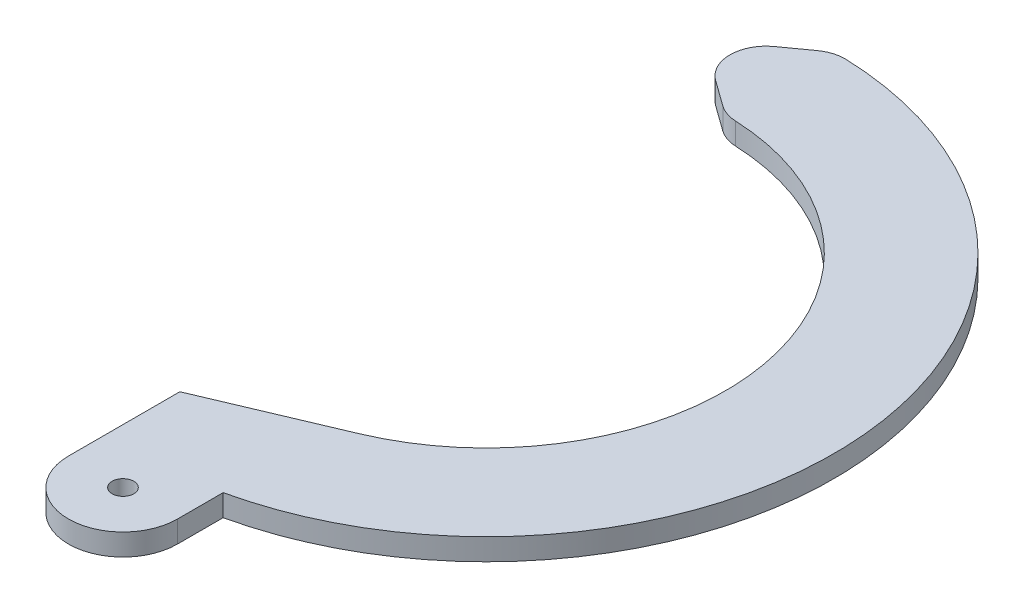
from build123d import *

# Parameters (mm, degrees)
SKETCH1_R           = 1.5
BOSS_EXTRUDE2_DEPTH = 3
FILLET1_R           = 5
FILLET2_R           = 5
CUT_EXTRUDE1_DEPTH  = 3


with BuildPart() as part:
    # Sketch1 → Boss-Extrude2 (new body)
    with BuildSketch(Plane(origin=(0, 0, 0), x_dir=(1, 0, 0), z_dir=(0, 1, 0))):
        with BuildLine():
            Line((-4.553675432, -32.684308774), (-4.553675432, -53.14))
            ThreePointArc((-4.553675432, -53.14), (2.973162284, -60.666837716), (10.5, -53.14))
            Line((10.5, -53.14), (10.5, -46.837484988))
            ThreePointArc((10.5, -46.837484988), (47.708486035, 5.282079163), (0, 48))
            Line((0, 48), (-10.422195737, 40.5))
            Line((-10.422195737, 40.5), (0, 33))
            ThreePointArc((0, 33), (32.920982591, -2.282302614), (-4.553675432, -32.684308774))
        make_face()
        with Locations((2.973162284, -53.14)):
            Circle(SKETCH1_R, mode=Mode.SUBTRACT)
    extrude(amount=BOSS_EXTRUDE2_DEPTH)

    # Fillet1
    fillet1_edges = [part.edges().sort_by_distance(p)[0] for p in [
        (-10.422195737, 1.5, -40.5),
    ]]
    fillet(fillet1_edges, radius=FILLET1_R)

    # Fillet2
    fillet2_edges = [part.edges().sort_by_distance(p)[0] for p in [
        (0, 1.5, -48),
        (0, 1.5, -33),
    ]]
    fillet(fillet2_edges, radius=FILLET2_R)

    # Sketch4 → Cut-Extrude1 (cut)
    with BuildSketch(Plane(origin=(0, 3, 0), x_dir=(1, 0, 0), z_dir=(0, 1, 0))):
        Polygon((12.894173945, -30.376640339), (-4.553675432, -37.76006069), (-8.400485765, -23.178826533), align=None)
    extrude(amount=-CUT_EXTRUDE1_DEPTH, mode=Mode.SUBTRACT)


solid = part.part
